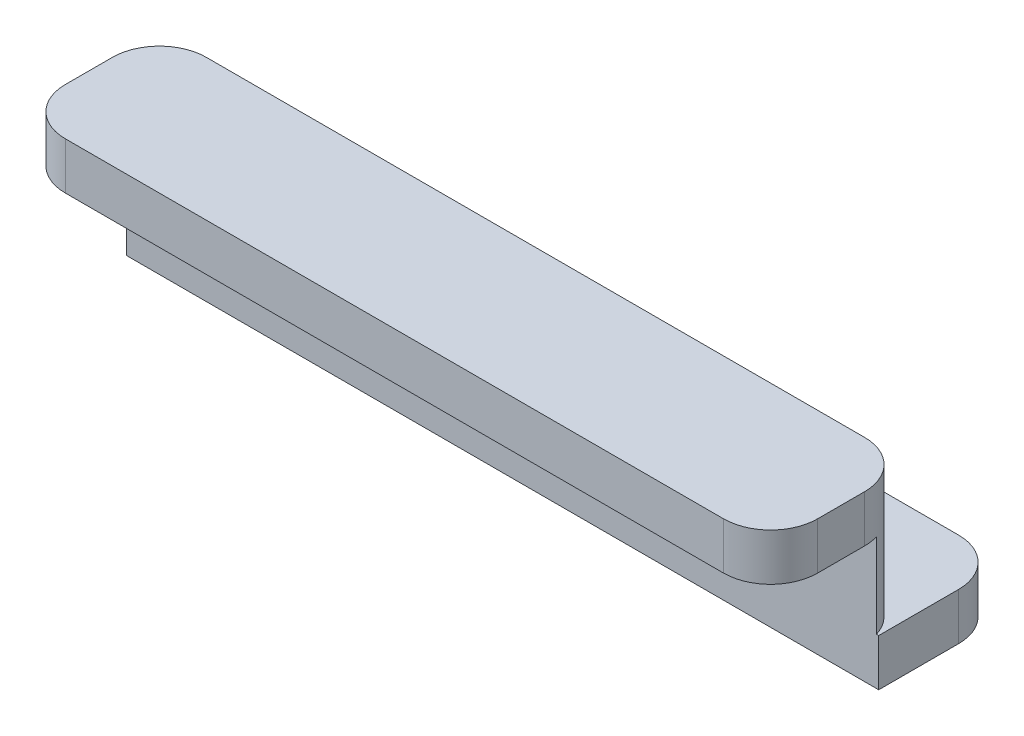
from build123d import *
from build123d.topology import SkipClean

# Parameters (mm, degrees)
BOSS_EXTRUDE1_DEPTH = 2
BOSS_EXTRUDE2_START = -7.6
BOSS_EXTRUDE2_DEPTH = 7.6
BOSS_EXTRUDE3_DEPTH = 2
SKETCH5_W           = 32
SKETCH5_H           = 4.6
CUT_EXTRUDE1_DEPTH  = 34.990586932


with BuildPart() as part:
    # Sketch1 → Boss-Extrude1 (new body)
    with BuildSketch(Plane(origin=(0, 0, 0), x_dir=(1, 0, 0), z_dir=(0, 1, 0))):
        with BuildLine():
            Line((2, 0), (30, 0))
            ThreePointArc((30, 0), (31.414213562, 0.585786438), (32, 2))
            Line((32, 2), (32, 4))
            ThreePointArc((32, 4), (31.414213562, 5.414213562), (30, 6))
            Line((30, 6), (2, 6))
            ThreePointArc((2, 6), (0.585786438, 5.414213562), (0, 4))
            Line((0, 4), (0, 2))
            ThreePointArc((0, 2), (0.585786438, 0.585786438), (2, 0))
        make_face()
    extrude(amount=BOSS_EXTRUDE1_DEPTH)

    # Sketch2 → Boss-Extrude2 (add)
    with SkipClean():  # the faces are left unmerged after this step: merging them gives an invalid solid
        with BuildSketch(Plane(origin=(0, 2, 0), x_dir=(1, 0, 0), z_dir=(0, 1, 0)).offset(BOSS_EXTRUDE2_START)):
            with BuildLine():
                Line((32, 4), (32, 2))
                ThreePointArc((32, 2), (31.449137675, 0.621595125), (30.1, 0.002501564))
                Line((30.1, 0.002501564), (30.1, 3.1))
                ThreePointArc((30.1, 3.1), (29.660660172, 4.160660172), (28.6, 4.6))
                Line((28.6, 4.6), (3.4, 4.6))
                ThreePointArc((3.4, 4.6), (2.339339828, 4.160660172), (1.9, 3.1))
                Line((1.9, 3.1), (1.9, 0.002501564))
                ThreePointArc((1.9, 0.002501564), (0.550862325, 0.621595125), (0, 2))
                Line((0, 2), (0, 4))
                ThreePointArc((0, 4), (0.585786438, 5.414213562), (2, 6))
                Line((2, 6), (30, 6))
                ThreePointArc((30, 6), (31.414213562, 5.414213562), (32, 4))
            make_face()
        extrude(amount=BOSS_EXTRUDE2_DEPTH)
    add(part.part.scale(1), mode=Mode.REPLACE)  # the faces are merged on a copy

    # Sketch4 → Boss-Extrude3 (add)
    with BuildSketch(Plane.XZ.offset(5.6)):
        with BuildLine():
            Line((30, -6), (2, -6))
            ThreePointArc((2, -6), (0.585786438, -5.414213562), (0, -4))
            Line((0, -4), (0, -8))
            ThreePointArc((0, -8), (0.585786438, -9.414213562), (2, -10))
            Line((2, -10), (30, -10))
            ThreePointArc((30, -10), (31.414213562, -9.414213562), (32, -8))
            Line((32, -8), (32, -4))
            ThreePointArc((32, -4), (31.414213562, -5.414213562), (30, -6))
        make_face()
    extrude(amount=-BOSS_EXTRUDE3_DEPTH)

    # Sketch5 → Cut-Extrude1 (cut, through all)
    with BuildSketch(Plane.XZ):
        with Locations((16, -2.3)):
            Rectangle(SKETCH5_W, SKETCH5_H)
    extrude(amount=CUT_EXTRUDE1_DEPTH, mode=Mode.SUBTRACT)


solid = part.part
